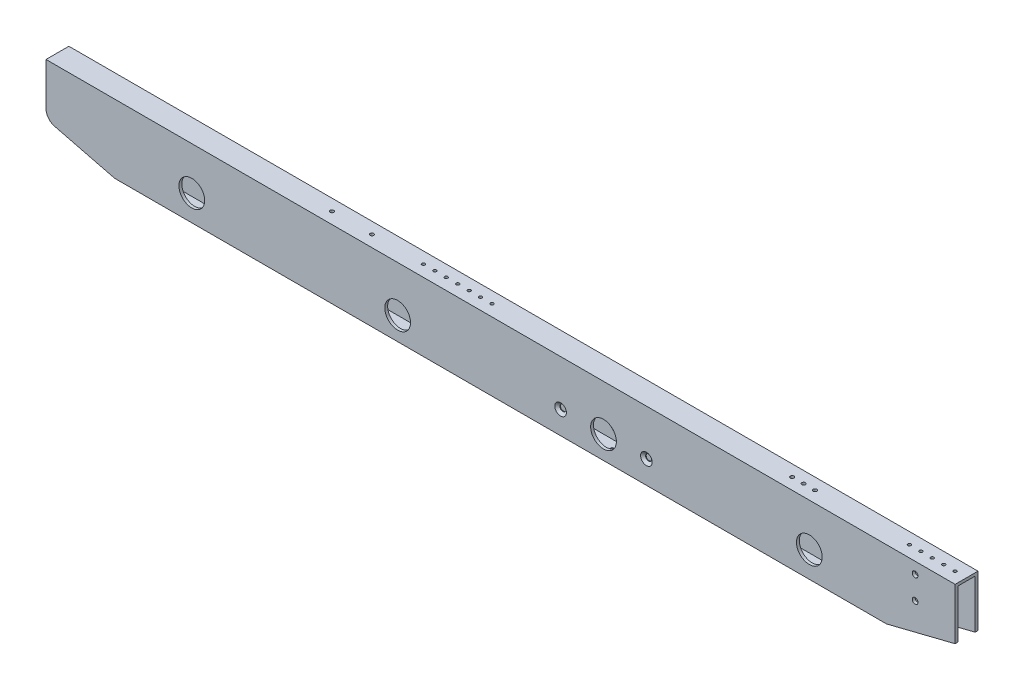
from build123d import *

# Parameters (mm, degrees)
SKETCH1_W                                           = 1009.65
SKETCH1_H                                           = 76.2
SKETCH1_R                                           = 14.2875
BOSS_EXTRUDE2_DEPTH                                 = 12.7
SKETCH3_W                                           = 19.05
SKETCH3_H                                           = 69.85
CUT_EXTRUDE2_DEPTH                                  = 1011.448426442
CUT_EXTRUDE3_DEPTH                                  = 507.897475457
FILLET1_R                                           = 12.7
SKETCH9_R                                           = 1.7272
CUT_EXTRUDE4_DEPTH                                  = 2.54
SKETCH12_R                                          = 1.7272
CUT_EXTRUDE7_DEPTH                                  = 5.08
CSK_FOR_1_4_FLAT_HEAD_MACHINE_SCREW_100_D           = 6.7564
CSK_FOR_1_4_FLAT_HEAD_MACHINE_SCREW_100_CSINK_D     = 12.8778
CSK_FOR_1_4_FLAT_HEAD_MACHINE_SCREW_100_CSINK_ANGLE = 100
CUT_EXTRUDE8_START                                  = -6.35
SKETCH17_R                                          = 1.7272
CUT_EXTRUDE8_DEPTH                                  = 6.35
SKETCH18_R                                          = 17.4625
CUT_EXTRUDE9_DEPTH                                  = 3.81
F_1_4_0_25_DIAMETER_HOLE1_D                         = 6.35
F_10_32_TAPPED_HOLE1_D                              = 4.0386
F_10_32_TAPPED_HOLE1_DEPTH                          = 13.716
F_10_32_TAPPED_HOLE1_TIP                            = 1.213317848
F_10_32_TAPPED_HOLE2_D                              = 4.0386


with BuildPart() as part:
    # Sketch1 → Boss-Extrude2 (new, symmetric)
    with BuildSketch(Plane.XY):
        Rectangle(SKETCH1_W, SKETCH1_H)
        with Locations((-114.3, -12.7)):
            Circle(SKETCH1_R, mode=Mode.SUBTRACT)
        with Locations((114.3, -12.7)):
            Circle(SKETCH1_R, mode=Mode.SUBTRACT)
        with Locations((-342.9, -9.525)):
            Circle(SKETCH1_R, mode=Mode.SUBTRACT)
        with Locations((342.9, -9.525)):
            Circle(SKETCH1_R, mode=Mode.SUBTRACT)
    extrude(amount=BOSS_EXTRUDE2_DEPTH, both=True)

    # Sketch3 → Cut-Extrude2 (cut, through all)
    with BuildSketch(Plane(origin=(504.825, 0, 0), x_dir=(0, 0, -1), z_dir=(1, 0, 0))):
        Rectangle(SKETCH3_W, SKETCH3_H)
    extrude(amount=-CUT_EXTRUDE2_DEPTH, mode=Mode.SUBTRACT)

    # Sketch4 → Cut-Extrude3 (cut, through all)
    with BuildSketch(Plane.XY.offset(12.7)):
        Polygon((-504.825, -38.1), (-504.825, -19.05), (-428.625, -38.1), align=None)
        Polygon((428.625, -38.1), (504.825, -38.1), (504.825, -19.05), align=None)
    extrude(amount=-CUT_EXTRUDE3_DEPTH, mode=Mode.SUBTRACT)

    # Fillet1
    fillet1_edges = [part.edges().sort_by_distance(p)[0] for p in [
        (-504.825, -19.05, -11.1125),
        (-504.825, -19.05, 11.1125),
    ]]
    fillet(fillet1_edges, radius=FILLET1_R)

    # Sketch9 → Cut-Extrude4 (cut)
    with BuildSketch(Plane(origin=(0, 38.1, 0), x_dir=(1, 0, 0), z_dir=(0, 1, 0))):
        with Locations((492.125, 0)):
            Circle(SKETCH9_R)
        with Locations((479.425, 0)):
            Circle(SKETCH9_R)
        with Locations((466.725, 0)):
            Circle(SKETCH9_R)
        with Locations((454.025, 0)):
            Circle(SKETCH9_R)
        with Locations((441.325, 0)):
            Circle(SKETCH9_R)
    extrude(amount=-CUT_EXTRUDE4_DEPTH, mode=Mode.SUBTRACT)

    # Sketch12 → Cut-Extrude7 (cut)
    with BuildSketch(Plane(origin=(0, 38.1, 0), x_dir=(1, 0, 0), z_dir=(0, 1, 0))):
        with Locations((-98.425, 0)):
            Circle(SKETCH12_R)
        with Locations((-85.725, 0)):
            Circle(SKETCH12_R)
        with Locations((-73.025, 0)):
            Circle(SKETCH12_R)
        with Locations((-60.325, 0)):
            Circle(SKETCH12_R)
        with Locations((-47.625, 0)):
            Circle(SKETCH12_R)
        with Locations((-34.925, 0)):
            Circle(SKETCH12_R)
        with Locations((-22.225, 0)):
            Circle(SKETCH12_R)
    extrude(amount=-CUT_EXTRUDE7_DEPTH, mode=Mode.SUBTRACT)

    # CSK for 1/4 Flat Head Machine Screw (100)2 (through all)
    with Locations(Plane.XY.offset(12.7)):
        with Locations((66.675, -12.7), (161.925, -12.7)):
            CounterSinkHole(CSK_FOR_1_4_FLAT_HEAD_MACHINE_SCREW_100_D / 2, CSK_FOR_1_4_FLAT_HEAD_MACHINE_SCREW_100_CSINK_D / 2, counter_sink_angle=CSK_FOR_1_4_FLAT_HEAD_MACHINE_SCREW_100_CSINK_ANGLE)

    # Sketch17 → Cut-Extrude8 (cut)
    with BuildSketch(Plane(origin=(0, -38.1, 0), x_dir=(-1, 0, 0), z_dir=(0, -1, 0)).offset(CUT_EXTRUDE8_START)):
        with Locations((-415.925, 0)):
            Circle(SKETCH17_R)
        with Locations((-396.875, 0)):
            Circle(SKETCH17_R)
        with Locations((-377.825, 0)):
            Circle(SKETCH17_R)
        with Locations((-358.775, 0)):
            Circle(SKETCH17_R)
        with Locations((-339.725, 0)):
            Circle(SKETCH17_R)
        with Locations((-320.675, 0)):
            Circle(SKETCH17_R)
        with Locations((-301.625, 0)):
            Circle(SKETCH17_R)
        with Locations((-282.575, 0)):
            Circle(SKETCH17_R)
        with Locations((-263.525, 0)):
            Circle(SKETCH17_R)
        with Locations((-244.475, 0)):
            Circle(SKETCH17_R)
        with Locations((-225.425, 0)):
            Circle(SKETCH17_R)
        with Locations((-206.375, 0)):
            Circle(SKETCH17_R)
        with Locations((-187.325, 0)):
            Circle(SKETCH17_R)
        with Locations((-168.275, 0)):
            Circle(SKETCH17_R)
        with Locations((-149.225, 0)):
            Circle(SKETCH17_R)
        with Locations((-130.175, 0)):
            Circle(SKETCH17_R)
        with Locations((-111.125, 0)):
            Circle(SKETCH17_R)
        with Locations((-92.075, 0)):
            Circle(SKETCH17_R)
        with Locations((-73.025, 0)):
            Circle(SKETCH17_R)
        with Locations((-53.975, 0)):
            Circle(SKETCH17_R)
        with Locations((-34.925, 0)):
            Circle(SKETCH17_R)
        with Locations((-15.875, 0)):
            Circle(SKETCH17_R)
        with Locations((3.175, 0)):
            Circle(SKETCH17_R)
        with Locations((22.225, 0)):
            Circle(SKETCH17_R)
        with Locations((41.275, 0)):
            Circle(SKETCH17_R)
        with Locations((60.325, 0)):
            Circle(SKETCH17_R)
    extrude(amount=CUT_EXTRUDE8_DEPTH, mode=Mode.SUBTRACT)

    # Sketch18 → Cut-Extrude9 (cut)
    with BuildSketch(Plane(origin=(0, 0, -12.7), x_dir=(-1, 0, 0), z_dir=(0, 0, -1))):
        with Locations((-114.3, -12.7)):
            Circle(SKETCH18_R)
    extrude(amount=-CUT_EXTRUDE9_DEPTH, mode=Mode.SUBTRACT)

    # 1/4 (0.25) Diameter Hole1 (through all)
    with Locations(Plane.XY.offset(12.7)):
        with Locations((460.375, 25.4), (460.375, 0)):
            Hole(F_1_4_0_25_DIAMETER_HOLE1_D / 2)

    # #10-32 Tapped Hole1
    with Locations(Plane(origin=(0, 38.1, 0), x_dir=(1, 0, 0), z_dir=(0, 1, 0))):
        with Locations((-155.575, 0), (-200.025, 0)):
            Hole(F_10_32_TAPPED_HOLE1_D / 2, depth=F_10_32_TAPPED_HOLE1_DEPTH)
            with Locations((0, 0, -(F_10_32_TAPPED_HOLE1_DEPTH + F_10_32_TAPPED_HOLE1_TIP / 2))):  # 118° drill point
                Cone(0, F_10_32_TAPPED_HOLE1_D / 2, F_10_32_TAPPED_HOLE1_TIP, mode=Mode.SUBTRACT)

    # #10-32 Tapped Hole2 (through all)
    with Locations(Plane(origin=(0, 38.1, 0), x_dir=(1, 0, 0), z_dir=(0, 1, 0))):
        with Locations((336.55, 0), (323.85, 0), (311.15, 0)):
            Hole(F_10_32_TAPPED_HOLE2_D / 2)


solid = part.part
